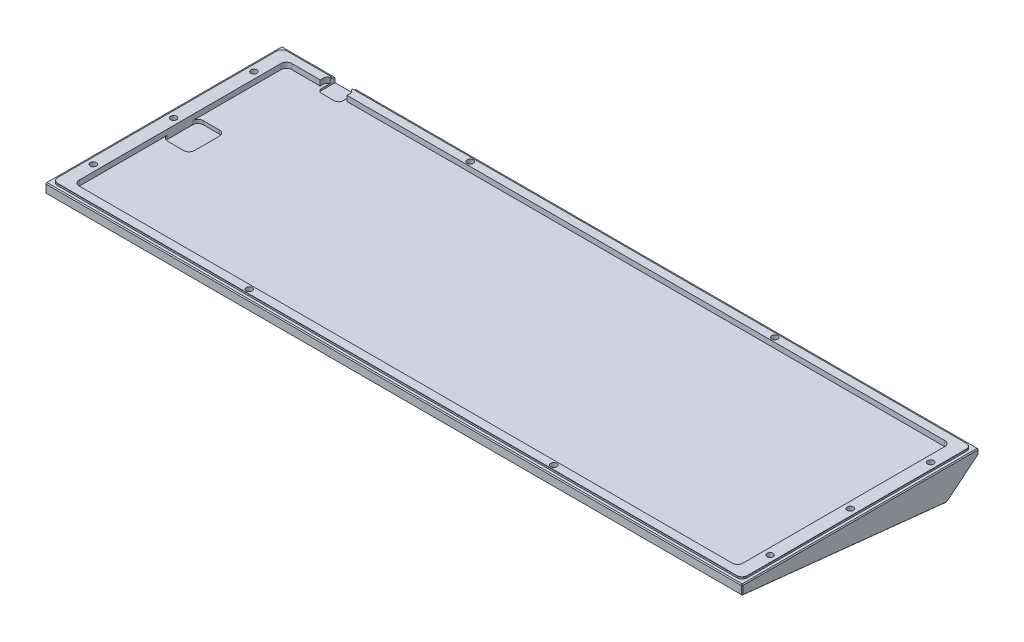
from build123d import *
from OCP.BRepFilletAPI import BRepFilletAPI_MakeChamfer

# Parameters (mm, degrees)
SKETCH1_W            = 390.7
SKETCH1_H            = 132.7
MAINBODY_DEPTH       = 18.5
SKETCH2_W            = 390.7
SKETCH2_H            = 132.7
SKETCH2_W_2          = 386.7
SKETCH2_H_2          = 128.7
ALIGMENTLIP_DEPTH    = 1
TYPINGANGLE_DEPTH    = 414.035143783
SKETCH4_W            = 372
SKETCH4_H            = 119.1
PCBCUTOUT_DEPTH      = 3
M3_CLEARANCE_HOLE1_D = 3.4
CUT_EXTRUDE2_START   = -1
SKETCH11_R           = 3.25
CUT_EXTRUDE2_DEPTH   = 412.911649145
SKETCH13_W           = 15
SKETCH13_H           = 20
CUT_EXTRUDE4_DEPTH   = 2
FILLET2_R            = 3
CHAMFER1_SIZE        = 0.5
CHAMFER1_SIZE2       = 0.561801899
CHAMFER2_SIZE        = 0.1
SKETCH17_R           = 1
SKETCH17_W           = 2
SKETCH17_H           = 2
CUT_EXTRUDE5_DEPTH   = 1
SKETCH18_W           = 12
SKETCH18_H           = 4
CUT_EXTRUDE6_DEPTH   = 10
SKETCH12_W           = 15
SKETCH12_H           = 3.95
CUT_EXTRUDE3_DEPTH   = 3
FILLET1_R            = 2.5


with BuildPart() as part:
    # Sketch1 → MainBody (new body)
    with BuildSketch(Plane(origin=(0, 0, 0), x_dir=(1, 0, 0), z_dir=(0, 1, 0))):
        with Locations((195.35, 66.35)):
            Rectangle(SKETCH1_W, SKETCH1_H)
    extrude(amount=MAINBODY_DEPTH)

    # Sketch2 → AligmentLip (cut)
    with BuildSketch(Plane(origin=(0, 18.5, 0), x_dir=(1, 0, 0), z_dir=(0, 1, 0))):
        with Locations((195.35, 66.35)):
            Rectangle(SKETCH2_W, SKETCH2_H)
        with Locations((195.35, 66.35)):
            Rectangle(SKETCH2_W_2, SKETCH2_H_2, mode=Mode.SUBTRACT)
    extrude(amount=-ALIGMENTLIP_DEPTH, mode=Mode.SUBTRACT)

    # Sketch3 → TypingAngle (cut, through all)
    with BuildSketch(Plane.ZY):
        Polygon((-114.79399123, 0), (-132.7, 14.5), (-132.7, 0), align=None)
        Polygon((0, 12.065334661), (-114.79399123, 0), (0, 0), align=None)
    extrude(amount=-TYPINGANGLE_DEPTH, mode=Mode.SUBTRACT)

    # Sketch4 → PCBCutout (cut)
    with BuildSketch(Plane(origin=(0, 18.5, 0), x_dir=(1, 0, 0), z_dir=(0, 1, 0))):
        with Locations((195.35, 66.35)):
            Rectangle(SKETCH4_W, SKETCH4_H)
    extrude(amount=-PCBCUTOUT_DEPTH, mode=Mode.SUBTRACT)

    # M3 Clearance Hole1 (through all)
    with Locations(Plane(origin=(110, 18.5, -128.3), x_dir=(0, 0, 1), z_dir=(0, 1, 0))):
        with Locations((0, 0), (16.95, -104.3), (61.95, -104.3), (106.95, -104.3), (123.9, 0), (0, 170.7), (123.9, 170.7), (106.95, 275), (61.95, 275), (16.95, 275)):
            Hole(M3_CLEARANCE_HOLE1_D / 2)

    # Sketch11 → Cut-Extrude2 (cut, through all)
    with BuildSketch(Plane(origin=(0, 15.5, 0), x_dir=(1, 0, 0), z_dir=(0, 1, 0)).offset(CUT_EXTRUDE2_START)):
        with Locations(Location((110, 128.3, 0), (0, 0, 270))):
            Circle(SKETCH11_R)
        with Locations(Location((5.7, 111.35, 0), (0, 0, 270))):
            Circle(SKETCH11_R)
        with Locations(Location((5.7, 66.35, 0), (0, 0, 270))):
            Circle(SKETCH11_R)
        with Locations(Location((5.7, 21.35, 0), (0, 0, 270))):
            Circle(SKETCH11_R)
        with Locations(Location((110, 4.4, 0), (0, 0, 270))):
            Circle(SKETCH11_R)
        with Locations(Location((280.7, 4.4, 0), (0, 0, 270))):
            Circle(SKETCH11_R)
        with Locations(Location((385, 21.35, 0), (0, 0, 270))):
            Circle(SKETCH11_R)
        with Locations(Location((385, 66.35, 0), (0, 0, 270))):
            Circle(SKETCH11_R)
        with Locations(Location((385, 111.35, 0), (0, 0, 270))):
            Circle(SKETCH11_R)
        with Locations(Location((280.7, 128.3, 0), (0, 0, 90))):
            Circle(SKETCH11_R)
    extrude(amount=-CUT_EXTRUDE2_DEPTH, mode=Mode.SUBTRACT)

    # Sketch13 → Cut-Extrude4 (cut)
    with BuildSketch(Plane(origin=(0, 15.5, 0), x_dir=(1, 0, 0), z_dir=(0, 1, 0))):
        with Locations((16.85, 66.35)):
            Rectangle(SKETCH13_W, SKETCH13_H)
    extrude(amount=-CUT_EXTRUDE4_DEPTH, mode=Mode.SUBTRACT)

    # Fillet2
    fillet2_edges = [part.edges().sort_by_distance(p)[0] for p in [
        (388.7, 18, -130.7),
        (2, 18, -130.7),
        (2, 18, -2),
        (9.35, 14.5, -56.35),
        (9.35, 14.5, -76.35),
        (24.35, 14.5, -76.35),
        (24.35, 14.5, -56.35),
        (388.7, 18, -2),
        (9.35, 17, -6.8),
        (9.35, 17, -125.9),
        (381.35, 17, -125.9),
        (381.35, 17, -6.8),
    ]]
    fillet(fillet2_edges, radius=FILLET2_R)

    # Chamfer1: one chamfer whose edges measure the first distance from different faces: ONE call of the kernel's chamfer builder (chamfer() names one face for all edges)
    chamfer1_edges_1 = [part.edges().sort_by_distance(p)[0] for p in [
        (0, 16, -132.7),
        (390.7, 16, -132.7),
        (390.7, 14.782667331, 0),
        (0, 14.782667331, 0),
        (195.35, 17.5, -132.7),
        (390.7, 17.5, -66.35),
        (195.35, 17.5, 0),
        (0, 17.5, -66.35),
        (0, 7.25, -123.746995615),
        (390.7, 7.25, -123.746995615),
        (0, 6.032667331, -57.396995615),
        (390.7, 6.032667331, -57.396995615),
    ]]
    chamfer1_edges_2 = [part.edges().sort_by_distance(p)[0] for p in [
        (195.35, 12.065334661, 0),
    ]]
    chamfer1_side_2 = [part.faces().sort_by_distance(p)[0] for p in [
        (195.35, 14.782667331, 0),
    ]]
    chamfer1 = BRepFilletAPI_MakeChamfer(part.part.solid().wrapped)
    for e in chamfer1_edges_1:
        chamfer1.Add(CHAMFER1_SIZE, e.wrapped)
    for e in chamfer1_edges_2:
        chamfer1.Add(CHAMFER1_SIZE, CHAMFER1_SIZE2, e.wrapped, chamfer1_side_2[0].wrapped)  # the first distance lies on this face
    add(Compound.cast(chamfer1.Shape()), mode=Mode.REPLACE)

    # Chamfer2
    chamfer2_edges = [part.edges().sort_by_distance(p)[0] for p in [
        (388.7, 18.5, -66.35),
        (195.35, 18.5, -130.7),
        (2, 18.5, -66.35),
        (195.35, 18.5, -2),
        (2.878679656, 18.5, -129.821320344),
        (2.878679656, 18.5, -2.878679656),
        (387.821320344, 18.5, -2.878679656),
        (387.821320344, 18.5, -129.821320344),
    ]]
    chamfer(chamfer2_edges, length=CHAMFER2_SIZE)

    # Sketch17 → Cut-Extrude5 (cut)
    with BuildSketch(Plane(origin=(0, 11.933506406, -1.254262065), x_dir=(1, 0, 0), z_dir=(0, -0.9945218953682734, 0.10452846326765429))):
        with Locations((205.1, -52.238829109)):
            Circle(SKETCH17_R)
        with BuildLine():
            ThreePointArc((204.1, -52.238829109), (205.1, -51.238829109), (206.1, -52.238829109))
            Line((206.1, -52.238829109), (206.1, -49.738829109))
            ThreePointArc((206.1, -49.738829109), (205.1, -50.738829109), (204.1, -49.738829109))
            Line((204.1, -49.738829109), (204.1, -52.238829109))
        make_face()
        with Locations((205.1, -49.738829109)):
            Circle(SKETCH17_R)
        with Locations((201.6, -49.738829109)):
            Circle(SKETCH17_R)
        with BuildLine():
            ThreePointArc((200.6, -60.238829109), (201.6, -59.238829109), (202.6, -60.238829109))
            Line((202.6, -60.238829109), (202.6, -49.738829109))
            ThreePointArc((202.6, -49.738829109), (201.6, -50.738829109), (200.6, -49.738829109))
            Line((200.6, -49.738829109), (200.6, -60.238829109))
        make_face()
        with Locations((201.6, -60.238829109)):
            Circle(SKETCH17_R)
        with Locations((197.1, -53.738829109)):
            Circle(SKETCH17_R)
        with BuildLine():
            Line((196.1, -62.738829109), (198.1, -62.738829109))
            Line((198.1, -62.738829109), (198.1, -53.738829109))
            ThreePointArc((198.1, -53.738829109), (197.1, -54.738829109), (196.1, -53.738829109))
            Line((196.1, -53.738829109), (196.1, -62.738829109))
        make_face()
        with Locations((197.1, -63.738829109)):
            Rectangle(SKETCH17_W, SKETCH17_H)
        with BuildLine():
            ThreePointArc((196.1, -67.738829109), (197.1, -66.738829109), (198.1, -67.738829109))
            Line((198.1, -67.738829109), (198.1, -64.738829109))
            Line((198.1, -64.738829109), (196.1, -64.738829109))
            Line((196.1, -64.738829109), (196.1, -67.738829109))
        make_face()
        with Locations((197.1, -67.738829109)):
            Circle(SKETCH17_R)
        with BuildLine():
            Line((194.1, -64.738829109), (196.1, -64.738829109))
            Line((196.1, -64.738829109), (196.1, -62.738829109))
            Line((196.1, -62.738829109), (194.1, -62.738829109))
            ThreePointArc((194.1, -62.738829109), (194.807106781, -63.031722328), (195.1, -63.738829109))
            ThreePointArc((195.1, -63.738829109), (194.807106781, -64.44593589), (194.1, -64.738829109))
        make_face()
        with Locations((194.1, -63.738829109)):
            Circle(SKETCH17_R)
        with Locations(Location((201.6, -63.738829109, 0), (0, 0, 270))):
            Circle(SKETCH17_R)
        with Locations((192.6, -60.238829109)):
            Circle(SKETCH17_R)
        with BuildLine():
            ThreePointArc((191.6, -60.238829109), (192.6, -59.238829109), (193.6, -60.238829109))
            Line((193.6, -60.238829109), (193.6, -54.238829109))
            ThreePointArc((193.6, -54.238829109), (192.6, -55.238829109), (191.6, -54.238829109))
            Line((191.6, -54.238829109), (191.6, -60.238829109))
        make_face()
        with Locations((192.6, -54.238829109)):
            Circle(SKETCH17_R)
        with BuildLine():
            ThreePointArc((188.1, -60.238829109), (189.1, -59.238829109), (190.1, -60.238829109))
            Line((190.1, -60.238829109), (190.1, -54.238829109))
            ThreePointArc((190.1, -54.238829109), (189.1, -55.238829109), (188.1, -54.238829109))
            Line((188.1, -54.238829109), (188.1, -60.238829109))
        make_face()
        with Locations((189.1, -60.238829109)):
            Circle(SKETCH17_R)
        with Locations((189.1, -54.238829109)):
            Circle(SKETCH17_R)
        with Locations((185.6, -54.238829109)):
            Circle(SKETCH17_R)
        with BuildLine():
            ThreePointArc((184.6, -60.238829109), (185.6, -59.238829109), (186.6, -60.238829109))
            Line((186.6, -60.238829109), (186.6, -54.238829109))
            ThreePointArc((186.6, -54.238829109), (185.6, -55.238829109), (184.6, -54.238829109))
            Line((184.6, -54.238829109), (184.6, -60.238829109))
        make_face()
        with Locations((185.6, -60.238829109)):
            Circle(SKETCH17_R)
    extrude(amount=-CUT_EXTRUDE5_DEPTH, mode=Mode.SUBTRACT)

    # Sketch18 → Cut-Extrude6 (cut)
    with BuildSketch(Plane(origin=(0, 0, -132.7), x_dir=(-1, 0, 0), z_dir=(0, 0, -1))):
        with Locations((-35.8, 16.5)):
            Rectangle(SKETCH18_W, SKETCH18_H)
    extrude(amount=-CUT_EXTRUDE6_DEPTH, mode=Mode.SUBTRACT)

    # Sketch12 → Cut-Extrude3 (cut)
    with BuildSketch(Plane(origin=(0, 18.5, 0), x_dir=(1, 0, 0), z_dir=(0, 1, 0))):
        with Locations((35.8, 127.875)):
            Rectangle(SKETCH12_W, SKETCH12_H)
    extrude(amount=-CUT_EXTRUDE3_DEPTH, mode=Mode.SUBTRACT)

    # Fillet1
    # the kernel refuses this fillet: 2.5 mm, written as the material it adds along each edge
    with BuildSketch(Plane(origin=(43.3, 18.5, -129.85), x_dir=(-1, 0, 0), z_dir=(0, -1, 0))) as fillet1_piece_1:
        with BuildLine():
            CenterArc((2.5, -2.291287847), FILLET1_R, 113.578178478, 66.421821522)
            Line((0, -2.291287847), (0, 0))
            Line((0, 0), (1.5, 0))
        make_face()
    extrude(amount=3)
    with BuildSketch(Plane(origin=(28.3, 18.5, -129.85), x_dir=(0, 0, 1), z_dir=(0, -1, 0))) as fillet1_piece_2:
        with BuildLine():
            CenterArc((2.291287847, -2.5), FILLET1_R, 90, 66.421821522)
            Line((0, -1.5), (0, 0))
            Line((0, 0), (2.291287847, 0))
        make_face()
    extrude(amount=3)
    with BuildSketch(Plane(origin=(41.8, 14.5, -122.7), x_dir=(-1, 0, 0), z_dir=(0, 1, 0)), Plane(origin=(29.8, 15.5, -122.7), x_dir=(1, 0, 0), z_dir=(0, -1, 0))) as fillet1_piece_3:
        with BuildLine():
            CenterArc((FILLET1_R, -FILLET1_R), FILLET1_R, 90, 90)
            Line((0, -FILLET1_R), (0, 0))
            Line((0, 0), (FILLET1_R, 0))
        make_face()
    extrude(amount=1)


solid = part.part
